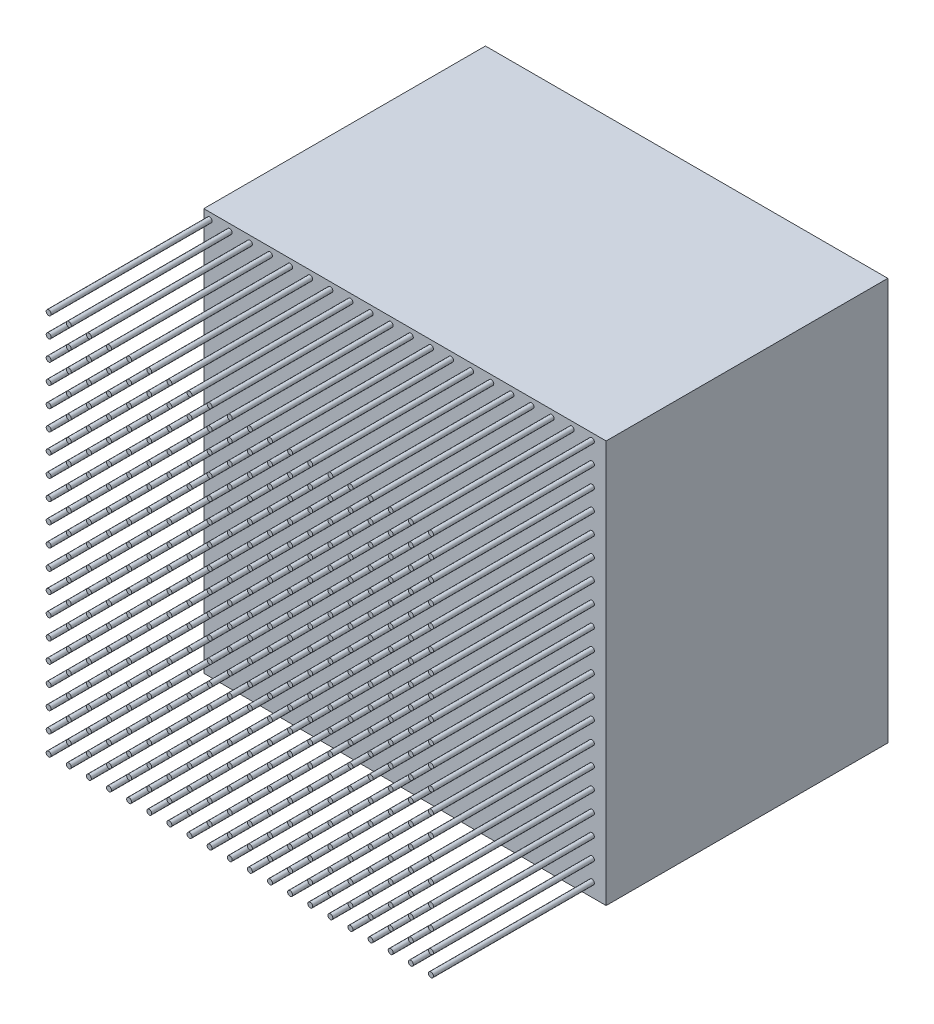
from build123d import *

# Parameters (mm, degrees)
SKETCH1_W           = 100
SKETCH1_H           = 100
BOSS_EXTRUDE1_DEPTH = 70
SKETCH2_R           = 0.616398495
BOSS_EXTRUDE2_DEPTH = 40
SKETCH3_W           = 86
SKETCH3_H           = 86
CUT_EXTRUDE1_DEPTH  = 27
CUT_EXTRUDE2_DEPTH  = 26


with BuildPart() as part:
    # Sketch1 → Boss-Extrude1 (new body)
    with BuildSketch(Plane.XY):
        Rectangle(SKETCH1_W, SKETCH1_H)
    extrude(amount=BOSS_EXTRUDE1_DEPTH)

    # Sketch2 → Boss-Extrude2 (add)
    with BuildSketch(Plane.XY.offset(70)):
        with Locations((-48.543961485, 48.331797905)):
            Circle(SKETCH2_R)
        with Locations((-43.543961485, 48.331797905)):
            Circle(SKETCH2_R)
        with Locations((-38.543961485, 48.331797905)):
            Circle(SKETCH2_R)
        with Locations((-33.543961485, 48.331797905)):
            Circle(SKETCH2_R)
        with Locations((-28.543961485, 48.331797905)):
            Circle(SKETCH2_R)
        with Locations((-23.543961485, 48.331797905)):
            Circle(SKETCH2_R)
        with Locations((-18.543961485, 48.331797905)):
            Circle(SKETCH2_R)
        with Locations((-13.543961485, 48.331797905)):
            Circle(SKETCH2_R)
        with Locations((-8.543961485, 48.331797905)):
            Circle(SKETCH2_R)
        with Locations((-3.543961485, 48.331797905)):
            Circle(SKETCH2_R)
        with Locations((1.456038515, 48.331797905)):
            Circle(SKETCH2_R)
        with Locations((6.456038515, 48.331797905)):
            Circle(SKETCH2_R)
        with Locations((11.456038515, 48.331797905)):
            Circle(SKETCH2_R)
        with Locations((16.456038515, 48.331797905)):
            Circle(SKETCH2_R)
        with Locations((21.456038515, 48.331797905)):
            Circle(SKETCH2_R)
        with Locations((26.456038515, 48.331797905)):
            Circle(SKETCH2_R)
        with Locations((31.456038515, 48.331797905)):
            Circle(SKETCH2_R)
        with Locations((36.456038515, 48.331797905)):
            Circle(SKETCH2_R)
        with Locations((41.456038515, 48.331797905)):
            Circle(SKETCH2_R)
        with Locations((46.456038515, 48.331797905)):
            Circle(SKETCH2_R)
        with Locations((-43.543961485, 43.331797905)):
            Circle(SKETCH2_R)
        with Locations((-38.543961485, 43.331797905)):
            Circle(SKETCH2_R)
        with Locations((-33.543961485, 43.331797905)):
            Circle(SKETCH2_R)
        with Locations((-28.543961485, 43.331797905)):
            Circle(SKETCH2_R)
        with Locations((-23.543961485, 43.331797905)):
            Circle(SKETCH2_R)
        with Locations((-18.543961485, 43.331797905)):
            Circle(SKETCH2_R)
        with Locations((-13.543961485, 43.331797905)):
            Circle(SKETCH2_R)
        with Locations((-8.543961485, 43.331797905)):
            Circle(SKETCH2_R)
        with Locations((-3.543961485, 43.331797905)):
            Circle(SKETCH2_R)
        with Locations((1.456038515, 43.331797905)):
            Circle(SKETCH2_R)
        with Locations((6.456038515, 43.331797905)):
            Circle(SKETCH2_R)
        with Locations((11.456038515, 43.331797905)):
            Circle(SKETCH2_R)
        with Locations((16.456038515, 43.331797905)):
            Circle(SKETCH2_R)
        with Locations((21.456038515, 43.331797905)):
            Circle(SKETCH2_R)
        with Locations((26.456038515, 43.331797905)):
            Circle(SKETCH2_R)
        with Locations((31.456038515, 43.331797905)):
            Circle(SKETCH2_R)
        with Locations((36.456038515, 43.331797905)):
            Circle(SKETCH2_R)
        with Locations((41.456038515, 43.331797905)):
            Circle(SKETCH2_R)
        with Locations((46.456038515, 43.331797905)):
            Circle(SKETCH2_R)
        with Locations((-43.543961485, 38.331797905)):
            Circle(SKETCH2_R)
        with Locations((-38.543961485, 38.331797905)):
            Circle(SKETCH2_R)
        with Locations((-33.543961485, 38.331797905)):
            Circle(SKETCH2_R)
        with Locations((-28.543961485, 38.331797905)):
            Circle(SKETCH2_R)
        with Locations((-23.543961485, 38.331797905)):
            Circle(SKETCH2_R)
        with Locations((-18.543961485, 38.331797905)):
            Circle(SKETCH2_R)
        with Locations((-13.543961485, 38.331797905)):
            Circle(SKETCH2_R)
        with Locations((-8.543961485, 38.331797905)):
            Circle(SKETCH2_R)
        with Locations((-3.543961485, 38.331797905)):
            Circle(SKETCH2_R)
        with Locations((1.456038515, 38.331797905)):
            Circle(SKETCH2_R)
        with Locations((6.456038515, 38.331797905)):
            Circle(SKETCH2_R)
        with Locations((11.456038515, 38.331797905)):
            Circle(SKETCH2_R)
        with Locations((16.456038515, 38.331797905)):
            Circle(SKETCH2_R)
        with Locations((21.456038515, 38.331797905)):
            Circle(SKETCH2_R)
        with Locations((26.456038515, 38.331797905)):
            Circle(SKETCH2_R)
        with Locations((31.456038515, 38.331797905)):
            Circle(SKETCH2_R)
        with Locations((36.456038515, 38.331797905)):
            Circle(SKETCH2_R)
        with Locations((41.456038515, 38.331797905)):
            Circle(SKETCH2_R)
        with Locations((46.456038515, 38.331797905)):
            Circle(SKETCH2_R)
        with Locations((-43.543961485, 33.331797905)):
            Circle(SKETCH2_R)
        with Locations((-38.543961485, 33.331797905)):
            Circle(SKETCH2_R)
        with Locations((-33.543961485, 33.331797905)):
            Circle(SKETCH2_R)
        with Locations((-28.543961485, 33.331797905)):
            Circle(SKETCH2_R)
        with Locations((-23.543961485, 33.331797905)):
            Circle(SKETCH2_R)
        with Locations((-18.543961485, 33.331797905)):
            Circle(SKETCH2_R)
        with Locations((-13.543961485, 33.331797905)):
            Circle(SKETCH2_R)
        with Locations((-8.543961485, 33.331797905)):
            Circle(SKETCH2_R)
        with Locations((-3.543961485, 33.331797905)):
            Circle(SKETCH2_R)
        with Locations((1.456038515, 33.331797905)):
            Circle(SKETCH2_R)
        with Locations((6.456038515, 33.331797905)):
            Circle(SKETCH2_R)
        with Locations((11.456038515, 33.331797905)):
            Circle(SKETCH2_R)
        with Locations((16.456038515, 33.331797905)):
            Circle(SKETCH2_R)
        with Locations((21.456038515, 33.331797905)):
            Circle(SKETCH2_R)
        with Locations((26.456038515, 33.331797905)):
            Circle(SKETCH2_R)
        with Locations((31.456038515, 33.331797905)):
            Circle(SKETCH2_R)
        with Locations((36.456038515, 33.331797905)):
            Circle(SKETCH2_R)
        with Locations((41.456038515, 33.331797905)):
            Circle(SKETCH2_R)
        with Locations((46.456038515, 33.331797905)):
            Circle(SKETCH2_R)
        with Locations((-43.543961485, 28.331797905)):
            Circle(SKETCH2_R)
        with Locations((-38.543961485, 28.331797905)):
            Circle(SKETCH2_R)
        with Locations((-33.543961485, 28.331797905)):
            Circle(SKETCH2_R)
        with Locations((-28.543961485, 28.331797905)):
            Circle(SKETCH2_R)
        with Locations((-23.543961485, 28.331797905)):
            Circle(SKETCH2_R)
        with Locations((-18.543961485, 28.331797905)):
            Circle(SKETCH2_R)
        with Locations((-13.543961485, 28.331797905)):
            Circle(SKETCH2_R)
        with Locations((-8.543961485, 28.331797905)):
            Circle(SKETCH2_R)
        with Locations((-3.543961485, 28.331797905)):
            Circle(SKETCH2_R)
        with Locations((1.456038515, 28.331797905)):
            Circle(SKETCH2_R)
        with Locations((6.456038515, 28.331797905)):
            Circle(SKETCH2_R)
        with Locations((11.456038515, 28.331797905)):
            Circle(SKETCH2_R)
        with Locations((16.456038515, 28.331797905)):
            Circle(SKETCH2_R)
        with Locations((21.456038515, 28.331797905)):
            Circle(SKETCH2_R)
        with Locations((26.456038515, 28.331797905)):
            Circle(SKETCH2_R)
        with Locations((31.456038515, 28.331797905)):
            Circle(SKETCH2_R)
        with Locations((36.456038515, 28.331797905)):
            Circle(SKETCH2_R)
        with Locations((41.456038515, 28.331797905)):
            Circle(SKETCH2_R)
        with Locations((46.456038515, 28.331797905)):
            Circle(SKETCH2_R)
        with Locations((-43.543961485, 23.331797905)):
            Circle(SKETCH2_R)
        with Locations((-38.543961485, 23.331797905)):
            Circle(SKETCH2_R)
        with Locations((-33.543961485, 23.331797905)):
            Circle(SKETCH2_R)
        with Locations((-28.543961485, 23.331797905)):
            Circle(SKETCH2_R)
        with Locations((-23.543961485, 23.331797905)):
            Circle(SKETCH2_R)
        with Locations((-18.543961485, 23.331797905)):
            Circle(SKETCH2_R)
        with Locations((-13.543961485, 23.331797905)):
            Circle(SKETCH2_R)
        with Locations((-8.543961485, 23.331797905)):
            Circle(SKETCH2_R)
        with Locations((-3.543961485, 23.331797905)):
            Circle(SKETCH2_R)
        with Locations((1.456038515, 23.331797905)):
            Circle(SKETCH2_R)
        with Locations((6.456038515, 23.331797905)):
            Circle(SKETCH2_R)
        with Locations((11.456038515, 23.331797905)):
            Circle(SKETCH2_R)
        with Locations((16.456038515, 23.331797905)):
            Circle(SKETCH2_R)
        with Locations((21.456038515, 23.331797905)):
            Circle(SKETCH2_R)
        with Locations((26.456038515, 23.331797905)):
            Circle(SKETCH2_R)
        with Locations((31.456038515, 23.331797905)):
            Circle(SKETCH2_R)
        with Locations((36.456038515, 23.331797905)):
            Circle(SKETCH2_R)
        with Locations((41.456038515, 23.331797905)):
            Circle(SKETCH2_R)
        with Locations((46.456038515, 23.331797905)):
            Circle(SKETCH2_R)
        with Locations((-43.543961485, 18.331797905)):
            Circle(SKETCH2_R)
        with Locations((-38.543961485, 18.331797905)):
            Circle(SKETCH2_R)
        with Locations((-33.543961485, 18.331797905)):
            Circle(SKETCH2_R)
        with Locations((-28.543961485, 18.331797905)):
            Circle(SKETCH2_R)
        with Locations((-23.543961485, 18.331797905)):
            Circle(SKETCH2_R)
        with Locations((-18.543961485, 18.331797905)):
            Circle(SKETCH2_R)
        with Locations((-13.543961485, 18.331797905)):
            Circle(SKETCH2_R)
        with Locations((-8.543961485, 18.331797905)):
            Circle(SKETCH2_R)
        with Locations((-3.543961485, 18.331797905)):
            Circle(SKETCH2_R)
        with Locations((1.456038515, 18.331797905)):
            Circle(SKETCH2_R)
        with Locations((6.456038515, 18.331797905)):
            Circle(SKETCH2_R)
        with Locations((11.456038515, 18.331797905)):
            Circle(SKETCH2_R)
        with Locations((16.456038515, 18.331797905)):
            Circle(SKETCH2_R)
        with Locations((21.456038515, 18.331797905)):
            Circle(SKETCH2_R)
        with Locations((26.456038515, 18.331797905)):
            Circle(SKETCH2_R)
        with Locations((31.456038515, 18.331797905)):
            Circle(SKETCH2_R)
        with Locations((36.456038515, 18.331797905)):
            Circle(SKETCH2_R)
        with Locations((41.456038515, 18.331797905)):
            Circle(SKETCH2_R)
        with Locations((46.456038515, 18.331797905)):
            Circle(SKETCH2_R)
        with Locations((-43.543961485, 13.331797905)):
            Circle(SKETCH2_R)
        with Locations((-38.543961485, 13.331797905)):
            Circle(SKETCH2_R)
        with Locations((-33.543961485, 13.331797905)):
            Circle(SKETCH2_R)
        with Locations((-28.543961485, 13.331797905)):
            Circle(SKETCH2_R)
        with Locations((-23.543961485, 13.331797905)):
            Circle(SKETCH2_R)
        with Locations((-18.543961485, 13.331797905)):
            Circle(SKETCH2_R)
        with Locations((-13.543961485, 13.331797905)):
            Circle(SKETCH2_R)
        with Locations((-8.543961485, 13.331797905)):
            Circle(SKETCH2_R)
        with Locations((-3.543961485, 13.331797905)):
            Circle(SKETCH2_R)
        with Locations((1.456038515, 13.331797905)):
            Circle(SKETCH2_R)
        with Locations((6.456038515, 13.331797905)):
            Circle(SKETCH2_R)
        with Locations((11.456038515, 13.331797905)):
            Circle(SKETCH2_R)
        with Locations((16.456038515, 13.331797905)):
            Circle(SKETCH2_R)
        with Locations((21.456038515, 13.331797905)):
            Circle(SKETCH2_R)
        with Locations((26.456038515, 13.331797905)):
            Circle(SKETCH2_R)
        with Locations((31.456038515, 13.331797905)):
            Circle(SKETCH2_R)
        with Locations((36.456038515, 13.331797905)):
            Circle(SKETCH2_R)
        with Locations((41.456038515, 13.331797905)):
            Circle(SKETCH2_R)
        with Locations((46.456038515, 13.331797905)):
            Circle(SKETCH2_R)
        with Locations((-43.543961485, 8.331797905)):
            Circle(SKETCH2_R)
        with Locations((-38.543961485, 8.331797905)):
            Circle(SKETCH2_R)
        with Locations((-33.543961485, 8.331797905)):
            Circle(SKETCH2_R)
        with Locations((-28.543961485, 8.331797905)):
            Circle(SKETCH2_R)
        with Locations((-23.543961485, 8.331797905)):
            Circle(SKETCH2_R)
        with Locations((-18.543961485, 8.331797905)):
            Circle(SKETCH2_R)
        with Locations((-13.543961485, 8.331797905)):
            Circle(SKETCH2_R)
        with Locations((-8.543961485, 8.331797905)):
            Circle(SKETCH2_R)
        with Locations((-3.543961485, 8.331797905)):
            Circle(SKETCH2_R)
        with Locations((1.456038515, 8.331797905)):
            Circle(SKETCH2_R)
        with Locations((6.456038515, 8.331797905)):
            Circle(SKETCH2_R)
        with Locations((11.456038515, 8.331797905)):
            Circle(SKETCH2_R)
        with Locations((16.456038515, 8.331797905)):
            Circle(SKETCH2_R)
        with Locations((21.456038515, 8.331797905)):
            Circle(SKETCH2_R)
        with Locations((26.456038515, 8.331797905)):
            Circle(SKETCH2_R)
        with Locations((31.456038515, 8.331797905)):
            Circle(SKETCH2_R)
        with Locations((36.456038515, 8.331797905)):
            Circle(SKETCH2_R)
        with Locations((41.456038515, 8.331797905)):
            Circle(SKETCH2_R)
        with Locations((46.456038515, 8.331797905)):
            Circle(SKETCH2_R)
        with Locations((-43.543961485, 3.331797905)):
            Circle(SKETCH2_R)
        with Locations((-38.543961485, 3.331797905)):
            Circle(SKETCH2_R)
        with Locations((-33.543961485, 3.331797905)):
            Circle(SKETCH2_R)
        with Locations((-28.543961485, 3.331797905)):
            Circle(SKETCH2_R)
        with Locations((-23.543961485, 3.331797905)):
            Circle(SKETCH2_R)
        with Locations((-18.543961485, 3.331797905)):
            Circle(SKETCH2_R)
        with Locations((-13.543961485, 3.331797905)):
            Circle(SKETCH2_R)
        with Locations((-8.543961485, 3.331797905)):
            Circle(SKETCH2_R)
        with Locations((-3.543961485, 3.331797905)):
            Circle(SKETCH2_R)
        with Locations((1.456038515, 3.331797905)):
            Circle(SKETCH2_R)
        with Locations((6.456038515, 3.331797905)):
            Circle(SKETCH2_R)
        with Locations((11.456038515, 3.331797905)):
            Circle(SKETCH2_R)
        with Locations((16.456038515, 3.331797905)):
            Circle(SKETCH2_R)
        with Locations((21.456038515, 3.331797905)):
            Circle(SKETCH2_R)
        with Locations((26.456038515, 3.331797905)):
            Circle(SKETCH2_R)
        with Locations((31.456038515, 3.331797905)):
            Circle(SKETCH2_R)
        with Locations((36.456038515, 3.331797905)):
            Circle(SKETCH2_R)
        with Locations((41.456038515, 3.331797905)):
            Circle(SKETCH2_R)
        with Locations((46.456038515, 3.331797905)):
            Circle(SKETCH2_R)
        with Locations((-43.543961485, -1.668202095)):
            Circle(SKETCH2_R)
        with Locations((-38.543961485, -1.668202095)):
            Circle(SKETCH2_R)
        with Locations((-33.543961485, -1.668202095)):
            Circle(SKETCH2_R)
        with Locations((-28.543961485, -1.668202095)):
            Circle(SKETCH2_R)
        with Locations((-23.543961485, -1.668202095)):
            Circle(SKETCH2_R)
        with Locations((-18.543961485, -1.668202095)):
            Circle(SKETCH2_R)
        with Locations((-13.543961485, -1.668202095)):
            Circle(SKETCH2_R)
        with Locations((-8.543961485, -1.668202095)):
            Circle(SKETCH2_R)
        with Locations((-3.543961485, -1.668202095)):
            Circle(SKETCH2_R)
        with Locations((1.456038515, -1.668202095)):
            Circle(SKETCH2_R)
        with Locations((6.456038515, -1.668202095)):
            Circle(SKETCH2_R)
        with Locations((11.456038515, -1.668202095)):
            Circle(SKETCH2_R)
        with Locations((16.456038515, -1.668202095)):
            Circle(SKETCH2_R)
        with Locations((21.456038515, -1.668202095)):
            Circle(SKETCH2_R)
        with Locations((26.456038515, -1.668202095)):
            Circle(SKETCH2_R)
        with Locations((31.456038515, -1.668202095)):
            Circle(SKETCH2_R)
        with Locations((36.456038515, -1.668202095)):
            Circle(SKETCH2_R)
        with Locations((41.456038515, -1.668202095)):
            Circle(SKETCH2_R)
        with Locations((46.456038515, -1.668202095)):
            Circle(SKETCH2_R)
        with Locations((-43.543961485, -6.668202095)):
            Circle(SKETCH2_R)
        with Locations((-38.543961485, -6.668202095)):
            Circle(SKETCH2_R)
        with Locations((-33.543961485, -6.668202095)):
            Circle(SKETCH2_R)
        with Locations((-28.543961485, -6.668202095)):
            Circle(SKETCH2_R)
        with Locations((-23.543961485, -6.668202095)):
            Circle(SKETCH2_R)
        with Locations((-18.543961485, -6.668202095)):
            Circle(SKETCH2_R)
        with Locations((-13.543961485, -6.668202095)):
            Circle(SKETCH2_R)
        with Locations((-8.543961485, -6.668202095)):
            Circle(SKETCH2_R)
        with Locations((-3.543961485, -6.668202095)):
            Circle(SKETCH2_R)
        with Locations((1.456038515, -6.668202095)):
            Circle(SKETCH2_R)
        with Locations((6.456038515, -6.668202095)):
            Circle(SKETCH2_R)
        with Locations((11.456038515, -6.668202095)):
            Circle(SKETCH2_R)
        with Locations((16.456038515, -6.668202095)):
            Circle(SKETCH2_R)
        with Locations((21.456038515, -6.668202095)):
            Circle(SKETCH2_R)
        with Locations((26.456038515, -6.668202095)):
            Circle(SKETCH2_R)
        with Locations((31.456038515, -6.668202095)):
            Circle(SKETCH2_R)
        with Locations((36.456038515, -6.668202095)):
            Circle(SKETCH2_R)
        with Locations((41.456038515, -6.668202095)):
            Circle(SKETCH2_R)
        with Locations((46.456038515, -6.668202095)):
            Circle(SKETCH2_R)
        with Locations((-43.543961485, -11.668202095)):
            Circle(SKETCH2_R)
        with Locations((-38.543961485, -11.668202095)):
            Circle(SKETCH2_R)
        with Locations((-33.543961485, -11.668202095)):
            Circle(SKETCH2_R)
        with Locations((-28.543961485, -11.668202095)):
            Circle(SKETCH2_R)
        with Locations((-23.543961485, -11.668202095)):
            Circle(SKETCH2_R)
        with Locations((-18.543961485, -11.668202095)):
            Circle(SKETCH2_R)
        with Locations((-13.543961485, -11.668202095)):
            Circle(SKETCH2_R)
        with Locations((-8.543961485, -11.668202095)):
            Circle(SKETCH2_R)
        with Locations((-3.543961485, -11.668202095)):
            Circle(SKETCH2_R)
        with Locations((1.456038515, -11.668202095)):
            Circle(SKETCH2_R)
        with Locations((6.456038515, -11.668202095)):
            Circle(SKETCH2_R)
        with Locations((11.456038515, -11.668202095)):
            Circle(SKETCH2_R)
        with Locations((16.456038515, -11.668202095)):
            Circle(SKETCH2_R)
        with Locations((21.456038515, -11.668202095)):
            Circle(SKETCH2_R)
        with Locations((26.456038515, -11.668202095)):
            Circle(SKETCH2_R)
        with Locations((31.456038515, -11.668202095)):
            Circle(SKETCH2_R)
        with Locations((36.456038515, -11.668202095)):
            Circle(SKETCH2_R)
        with Locations((41.456038515, -11.668202095)):
            Circle(SKETCH2_R)
        with Locations((46.456038515, -11.668202095)):
            Circle(SKETCH2_R)
        with Locations((-43.543961485, -16.668202095)):
            Circle(SKETCH2_R)
        with Locations((-38.543961485, -16.668202095)):
            Circle(SKETCH2_R)
        with Locations((-33.543961485, -16.668202095)):
            Circle(SKETCH2_R)
        with Locations((-28.543961485, -16.668202095)):
            Circle(SKETCH2_R)
        with Locations((-23.543961485, -16.668202095)):
            Circle(SKETCH2_R)
        with Locations((-18.543961485, -16.668202095)):
            Circle(SKETCH2_R)
        with Locations((-13.543961485, -16.668202095)):
            Circle(SKETCH2_R)
        with Locations((-8.543961485, -16.668202095)):
            Circle(SKETCH2_R)
        with Locations((-3.543961485, -16.668202095)):
            Circle(SKETCH2_R)
        with Locations((1.456038515, -16.668202095)):
            Circle(SKETCH2_R)
        with Locations((6.456038515, -16.668202095)):
            Circle(SKETCH2_R)
        with Locations((11.456038515, -16.668202095)):
            Circle(SKETCH2_R)
        with Locations((16.456038515, -16.668202095)):
            Circle(SKETCH2_R)
        with Locations((21.456038515, -16.668202095)):
            Circle(SKETCH2_R)
        with Locations((26.456038515, -16.668202095)):
            Circle(SKETCH2_R)
        with Locations((31.456038515, -16.668202095)):
            Circle(SKETCH2_R)
        with Locations((36.456038515, -16.668202095)):
            Circle(SKETCH2_R)
        with Locations((41.456038515, -16.668202095)):
            Circle(SKETCH2_R)
        with Locations((46.456038515, -16.668202095)):
            Circle(SKETCH2_R)
        with Locations((-43.543961485, -21.668202095)):
            Circle(SKETCH2_R)
        with Locations((-38.543961485, -21.668202095)):
            Circle(SKETCH2_R)
        with Locations((-33.543961485, -21.668202095)):
            Circle(SKETCH2_R)
        with Locations((-28.543961485, -21.668202095)):
            Circle(SKETCH2_R)
        with Locations((-23.543961485, -21.668202095)):
            Circle(SKETCH2_R)
        with Locations((-18.543961485, -21.668202095)):
            Circle(SKETCH2_R)
        with Locations((-13.543961485, -21.668202095)):
            Circle(SKETCH2_R)
        with Locations((-8.543961485, -21.668202095)):
            Circle(SKETCH2_R)
        with Locations((-3.543961485, -21.668202095)):
            Circle(SKETCH2_R)
        with Locations((1.456038515, -21.668202095)):
            Circle(SKETCH2_R)
        with Locations((6.456038515, -21.668202095)):
            Circle(SKETCH2_R)
        with Locations((11.456038515, -21.668202095)):
            Circle(SKETCH2_R)
        with Locations((16.456038515, -21.668202095)):
            Circle(SKETCH2_R)
        with Locations((21.456038515, -21.668202095)):
            Circle(SKETCH2_R)
        with Locations((26.456038515, -21.668202095)):
            Circle(SKETCH2_R)
        with Locations((31.456038515, -21.668202095)):
            Circle(SKETCH2_R)
        with Locations((36.456038515, -21.668202095)):
            Circle(SKETCH2_R)
        with Locations((41.456038515, -21.668202095)):
            Circle(SKETCH2_R)
        with Locations((46.456038515, -21.668202095)):
            Circle(SKETCH2_R)
        with Locations((-43.543961485, -26.668202095)):
            Circle(SKETCH2_R)
        with Locations((-38.543961485, -26.668202095)):
            Circle(SKETCH2_R)
        with Locations((-33.543961485, -26.668202095)):
            Circle(SKETCH2_R)
        with Locations((-28.543961485, -26.668202095)):
            Circle(SKETCH2_R)
        with Locations((-23.543961485, -26.668202095)):
            Circle(SKETCH2_R)
        with Locations((-18.543961485, -26.668202095)):
            Circle(SKETCH2_R)
        with Locations((-13.543961485, -26.668202095)):
            Circle(SKETCH2_R)
        with Locations((-8.543961485, -26.668202095)):
            Circle(SKETCH2_R)
        with Locations((-3.543961485, -26.668202095)):
            Circle(SKETCH2_R)
        with Locations((1.456038515, -26.668202095)):
            Circle(SKETCH2_R)
        with Locations((6.456038515, -26.668202095)):
            Circle(SKETCH2_R)
        with Locations((11.456038515, -26.668202095)):
            Circle(SKETCH2_R)
        with Locations((16.456038515, -26.668202095)):
            Circle(SKETCH2_R)
        with Locations((21.456038515, -26.668202095)):
            Circle(SKETCH2_R)
        with Locations((26.456038515, -26.668202095)):
            Circle(SKETCH2_R)
        with Locations((31.456038515, -26.668202095)):
            Circle(SKETCH2_R)
        with Locations((36.456038515, -26.668202095)):
            Circle(SKETCH2_R)
        with Locations((41.456038515, -26.668202095)):
            Circle(SKETCH2_R)
        with Locations((46.456038515, -26.668202095)):
            Circle(SKETCH2_R)
        with Locations((-43.543961485, -31.668202095)):
            Circle(SKETCH2_R)
        with Locations((-38.543961485, -31.668202095)):
            Circle(SKETCH2_R)
        with Locations((-33.543961485, -31.668202095)):
            Circle(SKETCH2_R)
        with Locations((-28.543961485, -31.668202095)):
            Circle(SKETCH2_R)
        with Locations((-23.543961485, -31.668202095)):
            Circle(SKETCH2_R)
        with Locations((-18.543961485, -31.668202095)):
            Circle(SKETCH2_R)
        with Locations((-13.543961485, -31.668202095)):
            Circle(SKETCH2_R)
        with Locations((-8.543961485, -31.668202095)):
            Circle(SKETCH2_R)
        with Locations((-3.543961485, -31.668202095)):
            Circle(SKETCH2_R)
        with Locations((1.456038515, -31.668202095)):
            Circle(SKETCH2_R)
        with Locations((6.456038515, -31.668202095)):
            Circle(SKETCH2_R)
        with Locations((11.456038515, -31.668202095)):
            Circle(SKETCH2_R)
        with Locations((16.456038515, -31.668202095)):
            Circle(SKETCH2_R)
        with Locations((21.456038515, -31.668202095)):
            Circle(SKETCH2_R)
        with Locations((26.456038515, -31.668202095)):
            Circle(SKETCH2_R)
        with Locations((31.456038515, -31.668202095)):
            Circle(SKETCH2_R)
        with Locations((36.456038515, -31.668202095)):
            Circle(SKETCH2_R)
        with Locations((41.456038515, -31.668202095)):
            Circle(SKETCH2_R)
        with Locations((46.456038515, -31.668202095)):
            Circle(SKETCH2_R)
        with Locations((-43.543961485, -36.668202095)):
            Circle(SKETCH2_R)
        with Locations((-38.543961485, -36.668202095)):
            Circle(SKETCH2_R)
        with Locations((-33.543961485, -36.668202095)):
            Circle(SKETCH2_R)
        with Locations((-28.543961485, -36.668202095)):
            Circle(SKETCH2_R)
        with Locations((-23.543961485, -36.668202095)):
            Circle(SKETCH2_R)
        with Locations((-18.543961485, -36.668202095)):
            Circle(SKETCH2_R)
        with Locations((-13.543961485, -36.668202095)):
            Circle(SKETCH2_R)
        with Locations((-8.543961485, -36.668202095)):
            Circle(SKETCH2_R)
        with Locations((-3.543961485, -36.668202095)):
            Circle(SKETCH2_R)
        with Locations((1.456038515, -36.668202095)):
            Circle(SKETCH2_R)
        with Locations((6.456038515, -36.668202095)):
            Circle(SKETCH2_R)
        with Locations((11.456038515, -36.668202095)):
            Circle(SKETCH2_R)
        with Locations((16.456038515, -36.668202095)):
            Circle(SKETCH2_R)
        with Locations((21.456038515, -36.668202095)):
            Circle(SKETCH2_R)
        with Locations((26.456038515, -36.668202095)):
            Circle(SKETCH2_R)
        with Locations((31.456038515, -36.668202095)):
            Circle(SKETCH2_R)
        with Locations((36.456038515, -36.668202095)):
            Circle(SKETCH2_R)
        with Locations((41.456038515, -36.668202095)):
            Circle(SKETCH2_R)
        with Locations((46.456038515, -36.668202095)):
            Circle(SKETCH2_R)
        with Locations((-43.543961485, -41.668202095)):
            Circle(SKETCH2_R)
        with Locations((-38.543961485, -41.668202095)):
            Circle(SKETCH2_R)
        with Locations((-33.543961485, -41.668202095)):
            Circle(SKETCH2_R)
        with Locations((-28.543961485, -41.668202095)):
            Circle(SKETCH2_R)
        with Locations((-23.543961485, -41.668202095)):
            Circle(SKETCH2_R)
        with Locations((-18.543961485, -41.668202095)):
            Circle(SKETCH2_R)
        with Locations((-13.543961485, -41.668202095)):
            Circle(SKETCH2_R)
        with Locations((-8.543961485, -41.668202095)):
            Circle(SKETCH2_R)
        with Locations((-3.543961485, -41.668202095)):
            Circle(SKETCH2_R)
        with Locations((1.456038515, -41.668202095)):
            Circle(SKETCH2_R)
        with Locations((6.456038515, -41.668202095)):
            Circle(SKETCH2_R)
        with Locations((11.456038515, -41.668202095)):
            Circle(SKETCH2_R)
        with Locations((16.456038515, -41.668202095)):
            Circle(SKETCH2_R)
        with Locations((21.456038515, -41.668202095)):
            Circle(SKETCH2_R)
        with Locations((26.456038515, -41.668202095)):
            Circle(SKETCH2_R)
        with Locations((31.456038515, -41.668202095)):
            Circle(SKETCH2_R)
        with Locations((36.456038515, -41.668202095)):
            Circle(SKETCH2_R)
        with Locations((41.456038515, -41.668202095)):
            Circle(SKETCH2_R)
        with Locations((46.456038515, -41.668202095)):
            Circle(SKETCH2_R)
        with Locations((-43.543961485, -46.668202095)):
            Circle(SKETCH2_R)
        with Locations((-38.543961485, -46.668202095)):
            Circle(SKETCH2_R)
        with Locations((-33.543961485, -46.668202095)):
            Circle(SKETCH2_R)
        with Locations((-28.543961485, -46.668202095)):
            Circle(SKETCH2_R)
        with Locations((-23.543961485, -46.668202095)):
            Circle(SKETCH2_R)
        with Locations((-18.543961485, -46.668202095)):
            Circle(SKETCH2_R)
        with Locations((-13.543961485, -46.668202095)):
            Circle(SKETCH2_R)
        with Locations((-8.543961485, -46.668202095)):
            Circle(SKETCH2_R)
        with Locations((-3.543961485, -46.668202095)):
            Circle(SKETCH2_R)
        with Locations((1.456038515, -46.668202095)):
            Circle(SKETCH2_R)
        with Locations((6.456038515, -46.668202095)):
            Circle(SKETCH2_R)
        with Locations((11.456038515, -46.668202095)):
            Circle(SKETCH2_R)
        with Locations((16.456038515, -46.668202095)):
            Circle(SKETCH2_R)
        with Locations((21.456038515, -46.668202095)):
            Circle(SKETCH2_R)
        with Locations((26.456038515, -46.668202095)):
            Circle(SKETCH2_R)
        with Locations((31.456038515, -46.668202095)):
            Circle(SKETCH2_R)
        with Locations((36.456038515, -46.668202095)):
            Circle(SKETCH2_R)
        with Locations((41.456038515, -46.668202095)):
            Circle(SKETCH2_R)
        with Locations((46.456038515, -46.668202095)):
            Circle(SKETCH2_R)
        with Locations((-48.543961485, 43.331797905)):
            Circle(SKETCH2_R)
        with Locations((-48.543961485, 38.331797905)):
            Circle(SKETCH2_R)
        with Locations((-48.543961485, 33.331797905)):
            Circle(SKETCH2_R)
        with Locations((-48.543961485, 28.331797905)):
            Circle(SKETCH2_R)
        with Locations((-48.543961485, 23.331797905)):
            Circle(SKETCH2_R)
        with Locations((-48.543961485, 18.331797905)):
            Circle(SKETCH2_R)
        with Locations((-48.543961485, 13.331797905)):
            Circle(SKETCH2_R)
        with Locations((-48.543961485, 8.331797905)):
            Circle(SKETCH2_R)
        with Locations((-48.543961485, 3.331797905)):
            Circle(SKETCH2_R)
        with Locations((-48.543961485, -1.668202095)):
            Circle(SKETCH2_R)
        with Locations((-48.543961485, -6.668202095)):
            Circle(SKETCH2_R)
        with Locations((-48.543961485, -11.668202095)):
            Circle(SKETCH2_R)
        with Locations((-48.543961485, -16.668202095)):
            Circle(SKETCH2_R)
        with Locations((-48.543961485, -21.668202095)):
            Circle(SKETCH2_R)
        with Locations((-48.543961485, -26.668202095)):
            Circle(SKETCH2_R)
        with Locations((-48.543961485, -31.668202095)):
            Circle(SKETCH2_R)
        with Locations((-48.543961485, -36.668202095)):
            Circle(SKETCH2_R)
        with Locations((-48.543961485, -41.668202095)):
            Circle(SKETCH2_R)
        with Locations((-48.543961485, -46.668202095)):
            Circle(SKETCH2_R)
    extrude(amount=BOSS_EXTRUDE2_DEPTH)

    # Sketch3 → Cut-Extrude1 (cut)
    with BuildSketch(Plane(origin=(0, 0, 0), x_dir=(-1, 0, 0), z_dir=(0, 0, -1))):
        Rectangle(SKETCH3_W, SKETCH3_H)
    extrude(amount=-CUT_EXTRUDE1_DEPTH, mode=Mode.SUBTRACT)

    # Sketch4 → Cut-Extrude2 (cut)
    with BuildSketch(Plane(origin=(0, 0, 27), x_dir=(-1, 0, 0), z_dir=(0, 0, -1))):
        with BuildLine():
            Line((-2.767046481, 6.42988754), (-2.767046481, 13.896448152))
            Line((-2.767046481, 13.896448152), (2.767046481, 13.896448152))
            Line((2.767046481, 13.896448152), (2.767046481, 6.42988754))
            ThreePointArc((2.767046481, 6.42988754), (0, -7), (-2.767046481, 6.42988754))
        make_face()
    extrude(amount=-CUT_EXTRUDE2_DEPTH, mode=Mode.SUBTRACT)


solid = part.part
